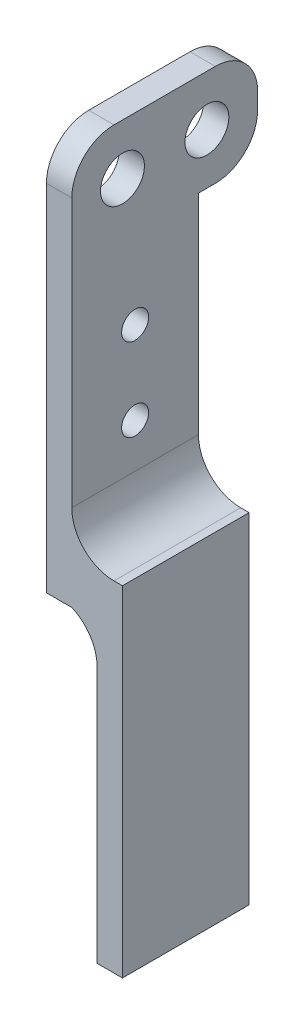
from build123d import *

# Parameters (mm, degrees)
SKETCH1_W           = 22
SKETCH1_H           = 12
SKETCH1_R           = 2.6
BOSS_EXTRUDE1_DEPTH = 3
SKETCH2_W           = 15
SKETCH2_H           = 36
BOSS_EXTRUDE2_DEPTH = 3
FILLET1_R           = 5
FILLET2_R           = 1
SKETCH4_W           = 15
SKETCH4_H           = 34.286255804
BOSS_EXTRUDE3_DEPTH = 12.2
SKETCH7_W           = 12.2
SKETCH7_H           = 15
CUT_EXTRUDE3_DEPTH  = 50
SKETCH8_R           = 1.6
CUT_EXTRUDE4_DEPTH  = 10
SKETCH9_W           = 15
SKETCH9_H           = 5.23
BOSS_EXTRUDE4_DEPTH = 6
SKETCH10_W          = 3
SKETCH10_H          = 15
BOSS_EXTRUDE5_DEPTH = 35
FILLET3_R           = 5
FILLET4_R           = 5
SKETCH11_W          = 15.033805152
SKETCH11_H          = 2.020668066
CUT_EXTRUDE5_DEPTH  = 3


with BuildPart() as part:
    # Sketch1 → Boss-Extrude1 (new body)
    with BuildSketch(Plane(origin=(0, 0, 0), x_dir=(0, 0, -1), z_dir=(1, 0, 0))):
        with Locations((5, 0)):
            Rectangle(SKETCH1_W, SKETCH1_H)
        with Locations((10, 0)):
            Circle(SKETCH1_R, mode=Mode.SUBTRACT)
        Circle(SKETCH1_R, mode=Mode.SUBTRACT)
    extrude(amount=BOSS_EXTRUDE1_DEPTH)

    # Sketch2 → Boss-Extrude2 (add)
    with BuildSketch(Plane(origin=(0, 0, 0), x_dir=(0, 0, -1), z_dir=(1, 0, 0))):
        with Locations((1.5, -24)):
            Rectangle(SKETCH2_W, SKETCH2_H)
    extrude(amount=BOSS_EXTRUDE2_DEPTH)

    # Fillet1
    fillet1_edges = [part.edges().sort_by_distance(p)[0] for p in [
        (1.5, -6, -16),
        (1.5, 6, 6),
        (1.5, 6, -16),
    ]]
    fillet(fillet1_edges, radius=FILLET1_R)

    # Fillet2
    fillet2_edges = [part.edges().sort_by_distance(p)[0] for p in [
        (1.5, -42, 6),
        (1.5, -42, -9),
    ]]
    fillet(fillet2_edges, radius=FILLET2_R)

    # Sketch4 → Boss-Extrude3 (add)
    with BuildSketch(Plane(origin=(3, 0, 0), x_dir=(0, 0, -1), z_dir=(1, 0, 0))):
        with Locations((1.5, -23.856872098)):
            Rectangle(SKETCH4_W, SKETCH4_H)
    extrude(amount=BOSS_EXTRUDE3_DEPTH)

    # Sketch7 → Cut-Extrude3 (cut)
    with BuildSketch(Plane(origin=(0, -6.713744196, 0), x_dir=(1, 0, 0), z_dir=(0, 1, 0))):
        with Locations((9.1, 1.5)):
            Rectangle(SKETCH7_W, SKETCH7_H)
    extrude(amount=-CUT_EXTRUDE3_DEPTH, mode=Mode.SUBTRACT)

    # Sketch8 → Cut-Extrude4 (cut)
    with BuildSketch(Plane(origin=(3, 0, 0), x_dir=(0, 0, -1), z_dir=(1, 0, 0))):
        with Locations((1.5, -15.75)):
            Circle(SKETCH8_R)
        with Locations((1.5, -25.55)):
            Circle(SKETCH8_R)
    extrude(amount=-CUT_EXTRUDE4_DEPTH, mode=Mode.SUBTRACT)

    # Sketch9 → Boss-Extrude4 (add)
    with BuildSketch(Plane(origin=(3, 0, 0), x_dir=(0, 0, -1), z_dir=(1, 0, 0))):
        with Locations((1.5, -38.385)):
            Rectangle(SKETCH9_W, SKETCH9_H)
    extrude(amount=BOSS_EXTRUDE4_DEPTH)

    # Sketch10 → Boss-Extrude5 (add)
    with BuildSketch(Plane(origin=(0, -41, 0), x_dir=(-1, 0, 0), z_dir=(0, -1, 0))):
        with Locations((-7.5, 1.5)):
            Rectangle(SKETCH10_W, SKETCH10_H)
    extrude(amount=BOSS_EXTRUDE5_DEPTH)

    # Fillet3
    # the kernel refuses this fillet: 5 mm, written as the material it adds along each edge
    with BuildSketch(Plane(origin=(6, -41, 6), x_dir=(0, -1, 0), z_dir=(0, 0, -1))) as fillet3_piece_1:
        with BuildLine():
            CenterArc((4.582575695, 5), FILLET3_R, 203.578178478, 66.421821522)
            Line((0, 3), (-0.091651514, 2.96))
            ThreePointArc((-0.091651514, 2.96), (-0.1, 1.5), (-0.1, 0))
            Line((-0.1, 0), (0, -0.1))
            Line((0, -0.1), (4.582575695, -0.1))
            Line((4.582575695, -0.1), (4.582575695, 0))
        make_face()
    extrude(amount=15)

    # Fillet4
    fillet4_edges = [part.edges().sort_by_distance(p)[0] for p in [
        (3, -35.77, -1.5),
    ]]
    fillet(fillet4_edges, radius=FILLET4_R)

    # Sketch11 → Cut-Extrude5 (cut)
    with BuildSketch(Plane(origin=(3, 0, 0), x_dir=(0, 0, -1), z_dir=(1, 0, 0))):
        with Locations((1.516902576, -42.010334033)):
            Rectangle(SKETCH11_W, SKETCH11_H)
    extrude(amount=-CUT_EXTRUDE5_DEPTH, mode=Mode.SUBTRACT)


solid = part.part
